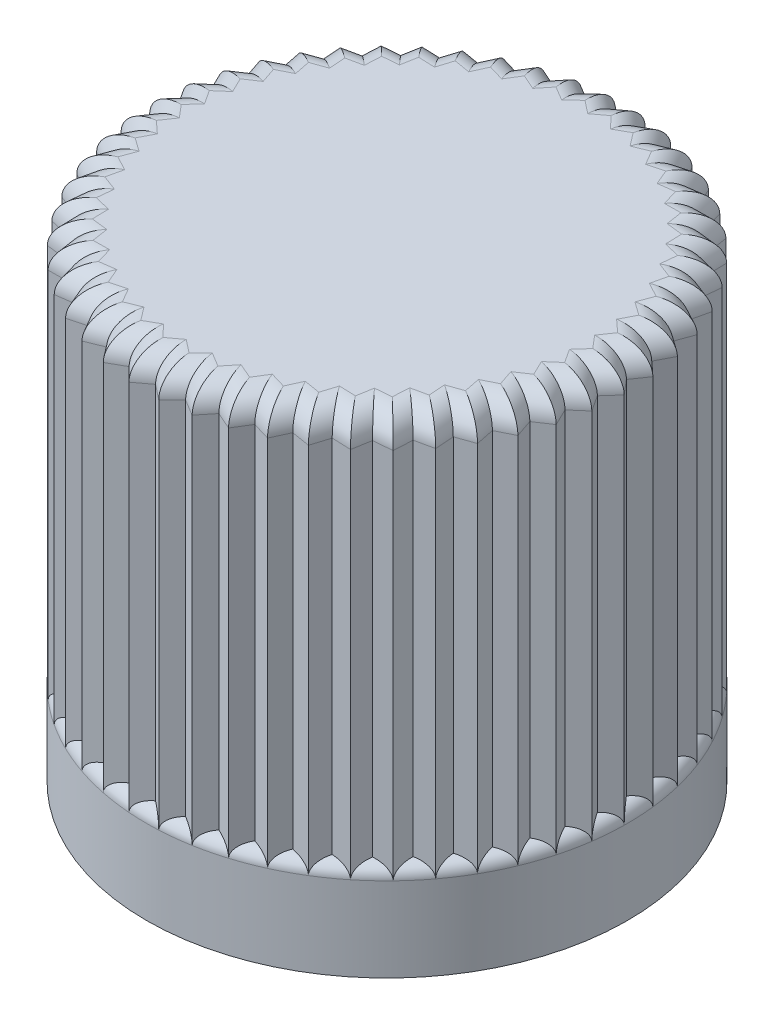
from build123d import *

# Parameters (mm, degrees)
SKETCH1_R           = 10
BOSS_EXTRUDE1_DEPTH = 20
SKETCH2_R           = 3.125
CUT_EXTRUDE1_DEPTH  = 17
SKETCH3_R           = 6
CUT_EXTRUDE2_DEPTH  = 4
SKETCH4_OUTSIDE_W   = 28.928
SKETCH4_OUTSIDE_H   = 28.928
CUT_EXTRUDE4_DEPTH  = 16
FILLET1_R           = 0.5
FILLET2_R           = 1


with BuildPart() as part:
    # Sketch1 → Boss-Extrude1 (new body)
    with BuildSketch(Plane(origin=(0, 0, 0), x_dir=(1, 0, 0), z_dir=(0, 1, 0))):
        with Locations(Location((0, 0, 0), (0, 0, 270))):
            Circle(SKETCH1_R)
    extrude(amount=BOSS_EXTRUDE1_DEPTH)

    # Sketch2 → Cut-Extrude1 (cut)
    with BuildSketch(Plane.XZ):
        with Locations(Location((0, 0, 0), (0, 0, 270))):
            Circle(SKETCH2_R)
    extrude(amount=-CUT_EXTRUDE1_DEPTH, mode=Mode.SUBTRACT)

    # Sketch3 → Cut-Extrude2 (cut)
    with BuildSketch(Plane.XZ):
        with Locations(Location((0, 0, 0), (0, 0, 270))):
            Circle(SKETCH3_R)
    extrude(amount=-CUT_EXTRUDE2_DEPTH, mode=Mode.SUBTRACT)

    # Sketch4 outside → Cut-Extrude4 (cut)
    with BuildSketch(Plane(origin=(0, 20, 0), x_dir=(1, 0, 0), z_dir=(0, 1, 0))):
        Rectangle(SKETCH4_OUTSIDE_W, SKETCH4_OUTSIDE_H)
        Polygon((9.307159291, -1.904412227), (9.651804953, -2.615848076), (8.995083418, -3.055891737), (9.24784489, -3.804913257), (8.541149705, -4.159178009), (8.698040789, -4.933972683), (7.95251696, -5.196871559), (8.011063389, -5.985220412), (7.238468272, -6.15260734), (7.197746733, -6.94207764), (6.410264614, -7.011312828), (6.270917312, -7.789454157), (5.480967255, -7.759445724), (5.245191779, -8.513986329), (4.465231768, -8.385207526), (4.136746438, -9.10424785), (3.379076908, -8.878729597), (2.963062134, -9.550929944), (2.239631987, -9.232228797), (1.742648571, -9.846988167), (1.064866732, -9.440130234), (0.494752399, -9.987753504), (-0.126692108, -9.499155179), (-0.760946314, -9.971006003), (-1.316252937, -9.408372771), (-2.00464445, -9.79700978), (-2.485055672, -9.169214705), (-3.216728144, -9.468508861), (-3.614667594, -8.785452645), (-4.378082115, -8.9906839), (-4.687274049, -8.263138749), (-5.470391115, -8.371070484), (-5.685959392, -7.610510219), (-6.476428779, -7.619440286), (-6.594973758, -6.837859397), (-7.380329293, -6.747646963), (-7.399981449, -5.957371446), (-8.167837605, -5.769439216), (-8.088287012, -4.98293219), (-8.826534238, -4.700243966), (-8.649035457, -3.929909116), (-9.346031154, -3.556923061), (-9.073383446, -2.814909028), (-9.718135576, -2.357507355), (-9.354638758, -1.655516143), (-9.936979194, -1.120912349), (-9.488365829, -0.470014779), (-9.999110714, 0.133360114), (-9.472455703, 0.722898999), (-9.903550286, 1.385529408), (-9.307159291, 1.904412227), (-9.651804953, 2.615848076), (-8.995083418, 3.055891737), (-9.24784489, 3.804913257), (-8.541149705, 4.159178009), (-8.698040789, 4.933972683), (-7.95251696, 5.196871559), (-8.011063389, 5.985220412), (-7.238468272, 6.15260734), (-7.197746733, 6.94207764), (-6.410264614, 7.011312828), (-6.270917312, 7.789454157), (-5.480967255, 7.759445724), (-5.245191779, 8.513986329), (-4.465231768, 8.385207526), (-4.136746438, 9.10424785), (-3.379076908, 8.878729597), (-2.963062134, 9.550929944), (-2.239631987, 9.232228797), (-1.742648571, 9.846988167), (-1.064866732, 9.440130234), (-0.494752399, 9.987753504), (0.126692108, 9.499155179), (0.760946314, 9.971006003), (1.316252937, 9.408372771), (2.00464445, 9.79700978), (2.485055672, 9.169214705), (3.216728144, 9.468508861), (3.614667594, 8.785452645), (4.378082115, 8.9906839), (4.687274049, 8.263138749), (5.470391115, 8.371070484), (5.685959392, 7.610510219), (6.476428779, 7.619440286), (6.594973758, 6.837859397), (7.380329293, 6.747646963), (7.399981449, 5.957371446), (8.167837605, 5.769439216), (8.088287012, 4.98293219), (8.826534238, 4.700243966), (8.649035457, 3.929909116), (9.346031154, 3.556923061), (9.073383446, 2.814909028), (9.718135576, 2.357507355), (9.354638758, 1.655516143), (9.936979194, 1.120912349), (9.488365829, 0.470014779), (9.999110714, -0.133360114), (9.472455703, -0.722898999), (9.903550286, -1.385529408), align=None, mode=Mode.SUBTRACT)
    extrude(amount=-CUT_EXTRUDE4_DEPTH, mode=Mode.SUBTRACT)

    # Fillet1
    # the kernel refuses this fillet: 0.5 mm, written as the material it takes off along each edge
    with BuildSketch(Plane(origin=(0, 4, 0), x_dir=(0.9999110714464502, 0, 0.01333601135317441), z_dir=(0.01333601135317441, 0, -0.9999110714464502))) as fillet1_piece_1_section:
        with BuildLine():
            CenterArc((10 - FILLET1_R, FILLET1_R), FILLET1_R, 270, 90)
            Line((10 - FILLET1_R, 0), (10, 0))
            Line((10, 0), (10, FILLET1_R))
        make_face()
    fillet1_piece_1 = revolve(axis=Axis((0, 4, 0), (0, -1, 0)), revolution_arc=7.2, mode=Mode.PRIVATE)
    fillet1_piece_1 = split(fillet1_piece_1, bisect_by=Plane(origin=(6.325043389, 4, -4.114951419), z_dir=(0.8382211116953275, 0, -0.545330512541018)), keep=Keep.TOP, mode=Mode.PRIVATE)
    fillet1_piece_1 = split(fillet1_piece_1, bisect_by=Plane(origin=(5.627358746, 4, 5.027109766), z_dir=(0.7457610349432742, 0, 0.6662135384096729)), keep=Keep.TOP, mode=Mode.PRIVATE)
    add(fillet1_piece_1, mode=Mode.SUBTRACT)
    with BuildSketch(Plane(origin=(0, 4, 0), x_dir=(0.9903550285633909, 0, 0.13855294078151292), z_dir=(0.13855294078151292, 0, -0.9903550285633909))) as fillet1_piece_2_section:
        with BuildLine():
            CenterArc((10 - FILLET1_R, FILLET1_R), FILLET1_R, 270, 90)
            Line((10 - FILLET1_R, 0), (10, 0))
            Line((10, 0), (10, FILLET1_R))
        make_face()
    fillet1_piece_2 = revolve(axis=Axis((0, 4, 0), (0, -1, 0)), revolution_arc=7.2, mode=Mode.PRIVATE)
    fillet1_piece_2 = split(fillet1_piece_2, bisect_by=Plane(origin=(4.952921419, 4, 5.692764573), z_dir=(0.6563817894215191, 0, 0.7544288876466784)), keep=Keep.TOP, mode=Mode.PRIVATE)
    fillet1_piece_2 = split(fillet1_piece_2, bisect_by=Plane(origin=(6.7909087, 4, -3.289765658), z_dir=(0.8999595243631443, 0, -0.4359734561966625)), keep=Keep.TOP, mode=Mode.PRIVATE)
    add(fillet1_piece_2, mode=Mode.SUBTRACT)
    with BuildSketch(Plane(origin=(0, 4, 0), x_dir=(0.965180495270469, 0, 0.26158480756621205), z_dir=(0.26158480756621205, 0, -0.965180495270469))) as fillet1_piece_3_section:
        with BuildLine():
            CenterArc((10 - FILLET1_R, FILLET1_R), FILLET1_R, 270, 90)
            Line((10 - FILLET1_R, 0), (10, 0))
            Line((10, 0), (10, FILLET1_R))
        make_face()
    fillet1_piece_3 = revolve(axis=Axis((0, 4, 0), (0, -1, 0)), revolution_arc=7.2, mode=Mode.PRIVATE)
    fillet1_piece_3 = split(fillet1_piece_3, bisect_by=Plane(origin=(7.149677325, 4, -2.412698327), z_dir=(0.9475050377219923, 0, -0.3197408380101701)), keep=Keep.TOP, mode=Mode.PRIVATE)
    fillet1_piece_3 = split(fillet1_piece_3, bisect_by=Plane(origin=(4.200373563, 4, 6.268641081), z_dir=(0.556651010977117, 0, 0.830746442651519)), keep=Keep.TOP, mode=Mode.PRIVATE)
    add(fillet1_piece_3, mode=Mode.SUBTRACT)
    with BuildSketch(Plane(origin=(0, 4, 0), x_dir=(0.9247844889962517, 0, 0.38049132567240146), z_dir=(0.38049132567240146, 0, -0.9247844889962517))) as fillet1_piece_4_section:
        with BuildLine():
            CenterArc((10 - FILLET1_R, FILLET1_R), FILLET1_R, 270, 90)
            Line((10 - FILLET1_R, 0), (10, 0))
            Line((10, 0), (10, FILLET1_R))
        make_face()
    fillet1_piece_4 = revolve(axis=Axis((0, 4, 0), (0, -1, 0)), revolution_arc=7.2, mode=Mode.PRIVATE)
    fillet1_piece_4 = split(fillet1_piece_4, bisect_by=Plane(origin=(7.395691266, 4, -1.497581302), z_dir=(0.9801078306238932, 0, -0.1984657158043319)), keep=Keep.TOP, mode=Mode.PRIVATE)
    fillet1_piece_4 = split(fillet1_piece_4, bisect_by=Plane(origin=(3.381583306, 4, 6.745657374), z_dir=(0.4481415135624047, 0, 0.8939626299918789)), keep=Keep.TOP, mode=Mode.PRIVATE)
    add(fillet1_piece_4, mode=Mode.SUBTRACT)
    with BuildSketch(Plane(origin=(0, 4, 0), x_dir=(0.8698040788910874, 0, 0.49339726827823754), z_dir=(0.49339726827823754, 0, -0.8698040788910874))) as fillet1_piece_5_section:
        with BuildLine():
            CenterArc((10 - FILLET1_R, FILLET1_R), FILLET1_R, 270, 90)
            Line((10 - FILLET1_R, 0), (10, 0))
            Line((10, 0), (10, FILLET1_R))
        make_face()
    fillet1_piece_5 = revolve(axis=Axis((0, 4, 0), (0, -1, 0)), revolution_arc=7.2, mode=Mode.PRIVATE)
    fillet1_piece_5 = split(fillet1_piece_5, bisect_by=Plane(origin=(7.525070739, 4, -0.558846525), z_dir=(0.9972537375488157, 0, -0.07406067070259273)), keep=Keep.TOP, mode=Mode.PRIVATE)
    fillet1_piece_5 = split(fillet1_piece_5, bisect_by=Plane(origin=(2.50946346, 4, 7.116290621), z_dir=(0.33256455677205254, 0, 0.9430804926298753)), keep=Keep.TOP, mode=Mode.PRIVATE)
    add(fillet1_piece_5, mode=Mode.SUBTRACT)
    with BuildSketch(Plane(origin=(0, 4, 0), x_dir=(0.8011063388660394, 0, 0.5985220412220842), z_dir=(0.5985220412220842, 0, -0.8011063388660394))) as fillet1_piece_6_section:
        with BuildLine():
            CenterArc((10 - FILLET1_R, FILLET1_R), FILLET1_R, 270, 90)
            Line((10 - FILLET1_R, 0), (10, 0))
            Line((10, 0), (10, FILLET1_R))
        make_face()
    fillet1_piece_6 = revolve(axis=Axis((0, 4, 0), (0, -1, 0)), revolution_arc=7.2, mode=Mode.PRIVATE)
    fillet1_piece_6 = split(fillet1_piece_6, bisect_by=Plane(origin=(7.53577535, 4, 0.388701595), z_dir=(0.998672357302087, 0, 0.05151235541782974)), keep=Keep.TOP, mode=Mode.PRIVATE)
    fillet1_piece_6 = split(fillet1_piece_6, bisect_by=Plane(origin=(1.597767877, 4, 7.374695714), z_dir=(0.21174285825696554, 0, 0.9773254125301207)), keep=Keep.TOP, mode=Mode.PRIVATE)
    add(fillet1_piece_6, mode=Mode.SUBTRACT)
    with BuildSketch(Plane(origin=(0, 4, 0), x_dir=(0.719774673319344, 0, 0.6942077640361217), z_dir=(0.6942077640361217, 0, -0.719774673319344))) as fillet1_piece_7_section:
        with BuildLine():
            CenterArc((10 - FILLET1_R, FILLET1_R), FILLET1_R, 270, 90)
            Line((10 - FILLET1_R, 0), (10, 0))
            Line((10, 0), (10, FILLET1_R))
        make_face()
    fillet1_piece_7 = revolve(axis=Axis((0, 4, 0), (0, -1, 0)), revolution_arc=7.2, mode=Mode.PRIVATE)
    fillet1_piece_7 = split(fillet1_piece_7, bisect_by=Plane(origin=(7.427636283, 4, 1.330119659), z_dir=(0.9843413174027552, 0, 0.1762730009213218)), keep=Keep.TOP, mode=Mode.PRIVATE)
    fillet1_piece_7 = split(fillet1_piece_7, bisect_by=Plane(origin=(0.660874539, 4, 7.51679745), z_dir=(0.08758184837811679, 0, 0.9961573268488632)), keep=Keep.TOP, mode=Mode.PRIVATE)
    add(fillet1_piece_7, mode=Mode.SUBTRACT)
    with BuildSketch(Plane(origin=(0, 4, 0), x_dir=(0.627091731201854, 0, 0.7789454157116926), z_dir=(0.7789454157116926, 0, -0.627091731201854))) as fillet1_piece_8_section:
        with BuildLine():
            CenterArc((10 - FILLET1_R, FILLET1_R), FILLET1_R, 270, 90)
            Line((10 - FILLET1_R, 0), (10, 0))
            Line((10, 0), (10, FILLET1_R))
        make_face()
    fillet1_piece_8 = revolve(axis=Axis((0, 4, 0), (0, -1, 0)), revolution_arc=7.2, mode=Mode.PRIVATE)
    fillet1_piece_8 = split(fillet1_piece_8, bisect_by=Plane(origin=(7.202358955, 4, 2.250560941), z_dir=(0.9544866269109806, 0, 0.2982537158999004)), keep=Keep.TOP, mode=Mode.PRIVATE)
    fillet1_piece_8 = split(fillet1_piece_8, bisect_by=Plane(origin=(-0.286441184, 4, 7.5403548), z_dir=(-0.03796037956851627, 0, 0.9992792450476564)), keep=Keep.TOP, mode=Mode.PRIVATE)
    add(fillet1_piece_8, mode=Mode.SUBTRACT)
    with BuildSketch(Plane(origin=(0, 4, 0), x_dir=(0.5245191778768692, 0, 0.8513986328620533), z_dir=(0.8513986328620533, 0, -0.5245191778768692))) as fillet1_piece_9_section:
        with BuildLine():
            CenterArc((10 - FILLET1_R, FILLET1_R), FILLET1_R, 270, 90)
            Line((10 - FILLET1_R, 0), (10, 0))
            Line((10, 0), (10, FILLET1_R))
        make_face()
    fillet1_piece_9 = revolve(axis=Axis((0, 4, 0), (0, -1, 0)), revolution_arc=7.2, mode=Mode.PRIVATE)
    fillet1_piece_9 = split(fillet1_piece_9, bisect_by=Plane(origin=(6.863496123, 4, 3.135509533), z_dir=(0.9095791121301484, 0, 0.41553079161059897)), keep=Keep.TOP, mode=Mode.PRIVATE)
    fillet1_piece_9 = split(fillet1_piece_9, bisect_by=Plane(origin=(-1.229239559, 4, 7.44499625), z_dir=(-0.16290394965292143, 0, 0.9866419326115622)), keep=Keep.TOP, mode=Mode.PRIVATE)
    add(fillet1_piece_9, mode=Mode.SUBTRACT)
    with BuildSketch(Plane(origin=(0, 4, 0), x_dir=(0.4136746437841964, 0, 0.9104247849712893), z_dir=(0.9104247849712893, 0, -0.4136746437841964))) as fillet1_piece_10_section:
        with BuildLine():
            CenterArc((10 - FILLET1_R, FILLET1_R), FILLET1_R, 270, 90)
            Line((10 - FILLET1_R, 0), (10, 0))
            Line((10, 0), (10, FILLET1_R))
        make_face()
    fillet1_piece_10 = revolve(axis=Axis((0, 4, 0), (0, -1, 0)), revolution_arc=7.2, mode=Mode.PRIVATE)
    fillet1_piece_10 = split(fillet1_piece_10, bisect_by=Plane(origin=(6.416391857, 4, 3.971009267), z_dir=(0.8503269913947983, 0, 0.5262546985115389)), keep=Keep.TOP, mode=Mode.PRIVATE)
    fillet1_piece_10 = split(fillet1_piece_10, bisect_by=Plane(origin=(-2.152652092, 4, 7.232225662), z_dir=(-0.28527842713720053, 0, 0.9584446875068613)), keep=Keep.TOP, mode=Mode.PRIVATE)
    add(fillet1_piece_10, mode=Mode.SUBTRACT)
    with BuildSketch(Plane(origin=(0, 4, 0), x_dir=(0.29630621344179275, 0, 0.9550929943601234), z_dir=(0.9550929943601234, 0, -0.29630621344179275))) as fillet1_piece_11_section:
        with BuildLine():
            CenterArc((10 - FILLET1_R, FILLET1_R), FILLET1_R, 270, 90)
            Line((10 - FILLET1_R, 0), (10, 0))
            Line((10, 0), (10, FILLET1_R))
        make_face()
    fillet1_piece_11 = revolve(axis=Axis((0, 4, 0), (0, -1, 0)), revolution_arc=7.2, mode=Mode.PRIVATE)
    fillet1_piece_11 = split(fillet1_piece_11, bisect_by=Plane(origin=(5.868097259, 4, 4.743883812), z_dir=(0.7776647060444283, 0, 0.6286792544476341)), keep=Keep.TOP, mode=Mode.PRIVATE)
    fillet1_piece_11 = split(fillet1_piece_11, bisect_by=Plane(origin=(-3.042116016, 4, 6.905398556), z_dir=(-0.4031538934084505, 0, 0.9151321971330741)), keep=Keep.TOP, mode=Mode.PRIVATE)
    add(fillet1_piece_11, mode=Mode.SUBTRACT)
    with BuildSketch(Plane(origin=(0, 4, 0), x_dir=(0.1742648571086599, 0, 0.984698816682999), z_dir=(0.984698816682999, 0, -0.1742648571086599))) as fillet1_piece_12_section:
        with BuildLine():
            CenterArc((10 - FILLET1_R, FILLET1_R), FILLET1_R, 270, 90)
            Line((10 - FILLET1_R, 0), (10, 0))
            Line((10, 0), (10, FILLET1_R))
        make_face()
    fillet1_piece_12 = revolve(axis=Axis((0, 4, 0), (0, -1, 0)), revolution_arc=7.2, mode=Mode.PRIVATE)
    fillet1_piece_12 = split(fillet1_piece_12, bisect_by=Plane(origin=(5.227259262, 4, 5.441944475), z_dir=(0.6927381837253628, 0, 0.7211891629863039)), keep=Keep.TOP, mode=Mode.PRIVATE)
    fillet1_piece_12 = split(fillet1_piece_12, bisect_by=Plane(origin=(-3.883603952, 4, 6.469669188), z_dir=(-0.5146713819481865, 0, 0.8573875253370229)), keep=Keep.TOP, mode=Mode.PRIVATE)
    add(fillet1_piece_12, mode=Mode.SUBTRACT)
    with BuildSketch(Plane(origin=(0, 4, 0), x_dir=(0, 0, 1), z_dir=(1, 0, 0))) as fillet1_piece_13_section:
        with BuildLine():
            CenterArc((10 - FILLET1_R, FILLET1_R), FILLET1_R, 270, 90)
            Line((10 - FILLET1_R, 0), (10, 0))
            Line((10, 0), (10, FILLET1_R))
        make_face()
    fillet1_piece_13 = revolve(axis=Axis((0, 4, 0), (0, -1, 0)), revolution_arc=4.364119817, mode=Mode.PRIVATE)
    fillet1_piece_13 = split(fillet1_piece_13, bisect_by=Plane(origin=(4.503984263, 4, 6.054182424), z_dir=(0.596886766427215, 0, 0.8023254876071576)), keep=Keep.TOP, mode=Mode.PRIVATE)
    fillet1_piece_13 = split(fillet1_piece_13, bisect_by=Plane(origin=(-4.663845134, 4, 5.931909273), z_dir=(-0.6180721953448227, 0, 0.7861213400879227)), keep=Keep.TOP, mode=Mode.PRIVATE)
    add(fillet1_piece_13, mode=Mode.SUBTRACT)
    with BuildSketch(Plane(origin=(0, 4, 0), x_dir=(-0.07609463144032622, 0, 0.9971006002735937), z_dir=(0.9971006002735937, 0, 0.07609463144032622))) as fillet1_piece_14_section:
        with BuildLine():
            CenterArc((10 - FILLET1_R, FILLET1_R), FILLET1_R, 270, 90)
            Line((10 - FILLET1_R, 0), (10, 0))
            Line((10, 0), (10, FILLET1_R))
        make_face()
    fillet1_piece_14 = revolve(axis=Axis((0, 4, 0), (0, -1, 0)), revolution_arc=7.2, mode=Mode.PRIVATE)
    fillet1_piece_14 = split(fillet1_piece_14, bisect_by=Plane(origin=(3.709678742, 4, 6.570942299), z_dir=(0.4916220882596396, 0, 0.870808660002432)), keep=Keep.TOP, mode=Mode.PRIVATE)
    fillet1_piece_14 = split(fillet1_piece_14, bisect_by=Plane(origin=(-5.370534693, 4, 5.300599605), z_dir=(-0.7117256410024367, 0, 0.7024575516995105)), keep=Keep.TOP, mode=Mode.PRIVATE)
    add(fillet1_piece_14, mode=Mode.SUBTRACT)
    with BuildSketch(Plane(origin=(0, 4, 0), x_dir=(-0.20046444496425275, 0, 0.9797009780056228), z_dir=(0.9797009780056228, 0, 0.20046444496425275))) as fillet1_piece_15_section:
        with BuildLine():
            CenterArc((10 - FILLET1_R, FILLET1_R), FILLET1_R, 270, 90)
            Line((10 - FILLET1_R, 0), (10, 0))
            Line((10, 0), (10, FILLET1_R))
        make_face()
    fillet1_piece_15 = revolve(axis=Axis((0, 4, 0), (0, -1, 0)), revolution_arc=7.2, mode=Mode.PRIVATE)
    fillet1_piece_15 = split(fillet1_piece_15, bisect_by=Plane(origin=(2.856869372, 4, 6.984074488), z_dir=(0.3786042360794077, 0, 0.9255586596335903)), keep=Keep.TOP, mode=Mode.PRIVATE)
    fillet1_piece_15 = split(fillet1_piece_15, bisect_by=Plane(origin=(-5.992527711, 4, 4.585696315), z_dir=(-0.7941547481371508, 0, 0.6077155880929982)), keep=Keep.TOP, mode=Mode.PRIVATE)
    add(fillet1_piece_15, mode=Mode.SUBTRACT)
    with BuildSketch(Plane(origin=(0, 4, 0), x_dir=(-0.3216728144394381, 0, 0.9468508860695071), z_dir=(0.9468508860695071, 0, 0.3216728144394381))) as fillet1_piece_16_section:
        with BuildLine():
            CenterArc((10 - FILLET1_R, FILLET1_R), FILLET1_R, 270, 90)
            Line((10 - FILLET1_R, 0), (10, 0))
            Line((10, 0), (10, FILLET1_R))
        make_face()
    fillet1_piece_16 = revolve(axis=Axis((0, 4, 0), (0, -1, 0)), revolution_arc=7.2, mode=Mode.PRIVATE)
    fillet1_piece_16 = split(fillet1_piece_16, bisect_by=Plane(origin=(1.959005464, 4, 7.287063651), z_dir=(0.25961556892899884, 0, 0.9657120463003827)), keep=Keep.TOP, mode=Mode.PRIVATE)
    fillet1_piece_16 = split(fillet1_piece_16, bisect_by=Plane(origin=(-6.520014988, 4, 3.798473855), z_dir=(-0.8640595604886911, 0, 0.503389586630564)), keep=Keep.TOP, mode=Mode.PRIVATE)
    add(fillet1_piece_16, mode=Mode.SUBTRACT)
    with BuildSketch(Plane(origin=(0, 4, 0), x_dir=(-0.4378082114728888, 0, 0.8990683900387726), z_dir=(0.8990683900387726, 0, 0.4378082114728888))) as fillet1_piece_17_section:
        with BuildLine():
            CenterArc((10 - FILLET1_R, FILLET1_R), FILLET1_R, 270, 90)
            Line((10 - FILLET1_R, 0), (10, 0))
            Line((10, 0), (10, FILLET1_R))
        make_face()
    fillet1_piece_17 = revolve(axis=Axis((0, 4, 0), (0, -1, 0)), revolution_arc=7.2, mode=Mode.PRIVATE)
    fillet1_piece_17 = split(fillet1_piece_17, bisect_by=Plane(origin=(1.03024687, 4, 7.475131467), z_dir=(0.13653260916974966, 0, 0.9906355771086058)), keep=Keep.TOP, mode=Mode.PRIVATE)
    fillet1_piece_17 = split(fillet1_piece_17, bisect_by=Plane(origin=(-6.944677733, 4, 2.951347193), z_dir=(-0.920337637407165, 0, 0.3911248306765984)), keep=Keep.TOP, mode=Mode.PRIVATE)
    add(fillet1_piece_17, mode=Mode.SUBTRACT)
    with BuildSketch(Plane(origin=(0, 4, 0), x_dir=(-0.5470391114774633, 0, 0.8371070484197032), z_dir=(0.8371070484197032, 0, 0.5470391114774633))) as fillet1_piece_18_section:
        with BuildLine():
            CenterArc((10 - FILLET1_R, FILLET1_R), FILLET1_R, 270, 90)
            Line((10 - FILLET1_R, 0), (10, 0))
            Line((10, 0), (10, FILLET1_R))
        make_face()
    fillet1_piece_18 = revolve(axis=Axis((0, 4, 0), (0, -1, 0)), revolution_arc=7.2, mode=Mode.PRIVATE)
    fillet1_piece_18 = split(fillet1_piece_18, bisect_by=Plane(origin=(0.085240668, 4, 7.545311994), z_dir=(0.011296448603270651, 0, 0.9999361930888159)), keep=Keep.TOP, mode=Mode.PRIVATE)
    fillet1_piece_18 = split(fillet1_piece_18, bisect_by=Plane(origin=(-7.259818762, 4, 2.057676022), z_dir=(-0.9621014400006704, 0, 0.2726918024962182)), keep=Keep.TOP, mode=Mode.PRIVATE)
    add(fillet1_piece_18, mode=Mode.SUBTRACT)
    with BuildSketch(Plane(origin=(0, 4, 0), x_dir=(-0.6476428779087129, 0, 0.7619440285835436), z_dir=(0.7619440285835436, 0, 0.6476428779087129))) as fillet1_piece_19_section:
        with BuildLine():
            CenterArc((10 - FILLET1_R, FILLET1_R), FILLET1_R, 270, 90)
            Line((10 - FILLET1_R, 0), (10, 0))
            Line((10, 0), (10, FILLET1_R))
        make_face()
    fillet1_piece_19 = revolve(axis=Axis((0, 4, 0), (0, -1, 0)), revolution_arc=7.2, mode=Mode.PRIVATE)
    fillet1_piece_19 = split(fillet1_piece_19, bisect_by=Plane(origin=(-0.861109831, 4, 7.496498444), z_dir=(-0.11411786370585471, 0, 0.9934672179710874)), keep=Keep.TOP, mode=Mode.PRIVATE)
    fillet1_piece_19 = split(fillet1_piece_19, bisect_by=Plane(origin=(-7.460468112, 4, 1.131554072), z_dir=(-0.9886923281538235, 0, 0.14995826169228682)), keep=Keep.TOP, mode=Mode.PRIVATE)
    add(fillet1_piece_19, mode=Mode.SUBTRACT)
    with BuildSketch(Plane(origin=(0, 4, 0), x_dir=(-0.7380329292722397, 0, 0.6747646962533214), z_dir=(0.6747646962533214, 0, 0.7380329292722397))) as fillet1_piece_20_section:
        with BuildLine():
            CenterArc((10 - FILLET1_R, FILLET1_R), FILLET1_R, 270, 90)
            Line((10 - FILLET1_R, 0), (10, 0))
            Line((10, 0), (10, FILLET1_R))
        make_face()
    fillet1_piece_20 = revolve(axis=Axis((0, 4, 0), (0, -1, 0)), revolution_arc=7.2, mode=Mode.PRIVATE)
    fillet1_piece_20 = split(fillet1_piece_20, bisect_by=Plane(origin=(-1.793880113, 4, 7.329460635), z_dir=(-0.23773246913362764, 0, 0.9713306713574059)), keep=Keep.TOP, mode=Mode.PRIVATE)
    fillet1_piece_20 = split(fillet1_piece_20, bisect_by=Plane(origin=(-7.543461423, 4, 0.187586837), z_dir=(-0.9996909476758228, 0, 0.024859789520738855)), keep=Keep.TOP, mode=Mode.PRIVATE)
    add(fillet1_piece_20, mode=Mode.SUBTRACT)
    with BuildSketch(Plane(origin=(0, 4, 0), x_dir=(-0.8167837604616416, 0, 0.5769439215782933), z_dir=(0.5769439215782933, 0, 0.8167837604616416))) as fillet1_piece_21_section:
        with BuildLine():
            CenterArc((10 - FILLET1_R, FILLET1_R), FILLET1_R, 270, 90)
            Line((10 - FILLET1_R, 0), (10, 0))
            Line((10, 0), (10, FILLET1_R))
        make_face()
    fillet1_piece_21 = revolve(axis=Axis((0, 4, 0), (0, -1, 0)), revolution_arc=7.2, mode=Mode.PRIVATE)
    fillet1_piece_21 = split(fillet1_piece_21, bisect_by=Plane(origin=(-2.698359834, 4, 7.046832854), z_dir=(-0.35759789150867455, 0, 0.9338756598115995)), keep=Keep.TOP, mode=Mode.PRIVATE)
    fillet1_piece_21 = split(fillet1_piece_21, bisect_by=Plane(origin=(-7.507489842, 4, -0.759338753), z_dir=(-0.9949238437665489, 0, -0.10063073638206234)), keep=Keep.TOP, mode=Mode.PRIVATE)
    add(fillet1_piece_21, mode=Mode.SUBTRACT)
    with BuildSketch(Plane(origin=(0, 4, 0), x_dir=(-0.8826534238255952, 0, 0.4700243966103822), z_dir=(0.4700243966103822, 0, 0.8826534238255952))) as fillet1_piece_22_section:
        with BuildLine():
            CenterArc((10 - FILLET1_R, FILLET1_R), FILLET1_R, 270, 90)
            Line((10 - FILLET1_R, 0), (10, 0))
            Line((10, 0), (10, FILLET1_R))
        make_face()
    fillet1_piece_22 = revolve(axis=Axis((0, 4, 0), (0, -1, 0)), revolution_arc=7.2, mode=Mode.PRIVATE)
    fillet1_piece_22 = split(fillet1_piece_22, bisect_by=Plane(origin=(-3.560284809, 4, 6.653072309), z_dir=(-0.47182378151600035, 0, 0.8816928712402872)), keep=Keep.TOP, mode=Mode.PRIVATE)
    fillet1_piece_22 = split(fillet1_piece_22, bisect_by=Plane(origin=(-7.35312066, 4, -1.694289118), z_dir=(-0.9744661965023799, 0, -0.22453425545823807)), keep=Keep.TOP, mode=Mode.PRIVATE)
    add(fillet1_piece_22, mode=Mode.SUBTRACT)
    with BuildSketch(Plane(origin=(0, 4, 0), x_dir=(-0.9346031154242219, 0, 0.3556923061289612), z_dir=(0.3556923061289612, 0, 0.9346031154242219))) as fillet1_piece_23_section:
        with BuildLine():
            CenterArc((10 - FILLET1_R, FILLET1_R), FILLET1_R, 270, 90)
            Line((10 - FILLET1_R, 0), (10, 0))
            Line((10, 0), (10, FILLET1_R))
        make_face()
    fillet1_piece_23 = revolve(axis=Axis((0, 4, 0), (0, -1, 0)), revolution_arc=7.2, mode=Mode.PRIVATE)
    fillet1_piece_23 = split(fillet1_piece_23, bisect_by=Plane(origin=(-4.366061965, 4, 6.154388839), z_dir=(-0.578608728634955, 0, 0.8156052593917237)), keep=Keep.TOP, mode=Mode.PRIVATE)
    fillet1_piece_23 = split(fillet1_piece_23, bisect_by=Plane(origin=(-7.082788374, 4, -2.602519532), z_dir=(-0.9386406352014821, 0, -0.34489673519556313)), keep=Keep.TOP, mode=Mode.PRIVATE)
    add(fillet1_piece_23, mode=Mode.SUBTRACT)
    with BuildSketch(Plane(origin=(0, 4, 0), x_dir=(-0.9718135575877694, 0, 0.23575073549960157), z_dir=(0.23575073549960157, 0, 0.9718135575877694))) as fillet1_piece_24_section:
        with BuildLine():
            CenterArc((10 - FILLET1_R, FILLET1_R), FILLET1_R, 270, 90)
            Line((10 - FILLET1_R, 0), (10, 0))
            Line((10, 0), (10, FILLET1_R))
        make_face()
    fillet1_piece_24 = revolve(axis=Axis((0, 4, 0), (0, -1, 0)), revolution_arc=7.2, mode=Mode.PRIVATE)
    fillet1_piece_24 = split(fillet1_piece_24, bisect_by=Plane(origin=(-5.102983716, 4, 5.558646981), z_dir=(-0.6762686704592366, 0, 0.7366550653835868)), keep=Keep.TOP, mode=Mode.PRIVATE)
    fillet1_piece_24 = split(fillet1_piece_24, bisect_by=Plane(origin=(-6.700756284, 4, -3.469706657), z_dir=(-0.8880121503667155, 0, -0.459819987387545)), keep=Keep.TOP, mode=Mode.PRIVATE)
    add(fillet1_piece_24, mode=Mode.SUBTRACT)
    with BuildSketch(Plane(origin=(0, 4, 0), x_dir=(-0.9936979194148782, 0, 0.11209123494075017), z_dir=(0.11209123494075017, 0, 0.9936979194148782))) as fillet1_piece_25_section:
        with BuildLine():
            CenterArc((10 - FILLET1_R, FILLET1_R), FILLET1_R, 270, 90)
            Line((10 - FILLET1_R, 0), (10, 0))
            Line((10, 0), (10, FILLET1_R))
        make_face()
    fillet1_piece_25 = revolve(axis=Axis((0, 4, 0), (0, -1, 0)), revolution_arc=7.2, mode=Mode.PRIVATE)
    fillet1_piece_25 = split(fillet1_piece_25, bisect_by=Plane(origin=(-5.759428366, 4, 4.875241939), z_dir=(-0.763263451367055, 0, 0.6460873809379436)), keep=Keep.TOP, mode=Mode.PRIVATE)
    fillet1_piece_25 = split(fillet1_piece_25, bisect_by=Plane(origin=(-6.213049264, 4, -4.282174436), z_dir=(-0.8233791834479235, 0, -0.5674916036952713)), keep=Keep.TOP, mode=Mode.PRIVATE)
    add(fillet1_piece_25, mode=Mode.SUBTRACT)
    with BuildSketch(Plane(origin=(0, 4, 0), x_dir=(-0.9999110714464502, 0, -0.013336011353174535), z_dir=(-0.013336011353174535, 0, 0.9999110714464502))) as fillet1_piece_26_section:
        with BuildLine():
            CenterArc((10 - FILLET1_R, FILLET1_R), FILLET1_R, 270, 90)
            Line((10 - FILLET1_R, 0), (10, 0))
            Line((10, 0), (10, FILLET1_R))
        make_face()
    fillet1_piece_26 = revolve(axis=Axis((0, 4, 0), (0, -1, 0)), revolution_arc=7.2, mode=Mode.PRIVATE)
    fillet1_piece_26 = split(fillet1_piece_26, bisect_by=Plane(origin=(-6.325043389, 4, 4.114951419), z_dir=(-0.8382211116953275, 0, 0.5453305125410178)), keep=Keep.TOP, mode=Mode.PRIVATE)
    fillet1_piece_26 = split(fillet1_piece_26, bisect_by=Plane(origin=(-5.627358746, 4, -5.027109766), z_dir=(-0.7457610349432768, 0, -0.6662135384096698)), keep=Keep.TOP, mode=Mode.PRIVATE)
    add(fillet1_piece_26, mode=Mode.SUBTRACT)
    with BuildSketch(Plane(origin=(0, 4, 0), x_dir=(-0.9903550285633906, 0, -0.13855294078151306), z_dir=(-0.13855294078151306, 0, 0.9903550285633906))) as fillet1_piece_27_section:
        with BuildLine():
            CenterArc((10 - FILLET1_R, FILLET1_R), FILLET1_R, 270, 90)
            Line((10 - FILLET1_R, 0), (10, 0))
            Line((10, 0), (10, FILLET1_R))
        make_face()
    fillet1_piece_27 = revolve(axis=Axis((0, 4, 0), (0, -1, 0)), revolution_arc=7.2, mode=Mode.PRIVATE)
    fillet1_piece_27 = split(fillet1_piece_27, bisect_by=Plane(origin=(-6.7909087, 4, 3.289765658), z_dir=(-0.8999595243631443, 0, 0.4359734561966624)), keep=Keep.TOP, mode=Mode.PRIVATE)
    fillet1_piece_27 = split(fillet1_piece_27, bisect_by=Plane(origin=(-4.952921419, 4, -5.692764573), z_dir=(-0.6563817894215223, 0, -0.7544288876466757)), keep=Keep.TOP, mode=Mode.PRIVATE)
    add(fillet1_piece_27, mode=Mode.SUBTRACT)
    with BuildSketch(Plane(origin=(0, 4, 0), x_dir=(-0.965180495270469, 0, -0.26158480756621216), z_dir=(-0.26158480756621216, 0, 0.965180495270469))) as fillet1_piece_28_section:
        with BuildLine():
            CenterArc((10 - FILLET1_R, FILLET1_R), FILLET1_R, 270, 90)
            Line((10 - FILLET1_R, 0), (10, 0))
            Line((10, 0), (10, FILLET1_R))
        make_face()
    fillet1_piece_28 = revolve(axis=Axis((0, 4, 0), (0, -1, 0)), revolution_arc=7.2, mode=Mode.PRIVATE)
    fillet1_piece_28 = split(fillet1_piece_28, bisect_by=Plane(origin=(-7.149677325, 4, 2.412698327), z_dir=(-0.9475050377219933, 0, 0.31974083801016745)), keep=Keep.TOP, mode=Mode.PRIVATE)
    fillet1_piece_28 = split(fillet1_piece_28, bisect_by=Plane(origin=(-4.200373563, 4, -6.268641081), z_dir=(-0.5566510109771139, 0, -0.8307464426515212)), keep=Keep.TOP, mode=Mode.PRIVATE)
    add(fillet1_piece_28, mode=Mode.SUBTRACT)
    with BuildSketch(Plane(origin=(0, 4, 0), x_dir=(-0.9247844889962515, 0, -0.380491325672402), z_dir=(-0.380491325672402, 0, 0.9247844889962515))) as fillet1_piece_29_section:
        with BuildLine():
            CenterArc((10 - FILLET1_R, FILLET1_R), FILLET1_R, 270, 90)
            Line((10 - FILLET1_R, 0), (10, 0))
            Line((10, 0), (10, FILLET1_R))
        make_face()
    fillet1_piece_29 = revolve(axis=Axis((0, 4, 0), (0, -1, 0)), revolution_arc=7.2, mode=Mode.PRIVATE)
    fillet1_piece_29 = split(fillet1_piece_29, bisect_by=Plane(origin=(-7.395691266, 4, 1.497581302), z_dir=(-0.9801078306238937, 0, 0.19846571580432953)), keep=Keep.TOP, mode=Mode.PRIVATE)
    fillet1_piece_29 = split(fillet1_piece_29, bisect_by=Plane(origin=(-3.381583306, 4, -6.745657374), z_dir=(-0.4481415135624065, 0, -0.893962629991878)), keep=Keep.TOP, mode=Mode.PRIVATE)
    add(fillet1_piece_29, mode=Mode.SUBTRACT)
    with BuildSketch(Plane(origin=(0, 4, 0), x_dir=(-0.8698040788910871, 0, -0.493397268278238), z_dir=(-0.493397268278238, 0, 0.8698040788910871))) as fillet1_piece_30_section:
        with BuildLine():
            CenterArc((10 - FILLET1_R, FILLET1_R), FILLET1_R, 270, 90)
            Line((10 - FILLET1_R, 0), (10, 0))
            Line((10, 0), (10, FILLET1_R))
        make_face()
    fillet1_piece_30 = revolve(axis=Axis((0, 4, 0), (0, -1, 0)), revolution_arc=7.2, mode=Mode.PRIVATE)
    fillet1_piece_30 = split(fillet1_piece_30, bisect_by=Plane(origin=(-7.525070739, 4, 0.558846525), z_dir=(-0.9972537375488159, 0, 0.07406067070259056)), keep=Keep.TOP, mode=Mode.PRIVATE)
    fillet1_piece_30 = split(fillet1_piece_30, bisect_by=Plane(origin=(-2.50946346, 4, -7.116290621), z_dir=(-0.33256455677205254, 0, -0.9430804926298753)), keep=Keep.TOP, mode=Mode.PRIVATE)
    add(fillet1_piece_30, mode=Mode.SUBTRACT)
    with BuildSketch(Plane(origin=(0, 4, 0), x_dir=(-0.8011063388660391, 0, -0.5985220412220846), z_dir=(-0.5985220412220846, 0, 0.8011063388660391))) as fillet1_piece_31_section:
        with BuildLine():
            CenterArc((10 - FILLET1_R, FILLET1_R), FILLET1_R, 270, 90)
            Line((10 - FILLET1_R, 0), (10, 0))
            Line((10, 0), (10, FILLET1_R))
        make_face()
    fillet1_piece_31 = revolve(axis=Axis((0, 4, 0), (0, -1, 0)), revolution_arc=7.2, mode=Mode.PRIVATE)
    fillet1_piece_31 = split(fillet1_piece_31, bisect_by=Plane(origin=(-7.53577535, 4, -0.388701595), z_dir=(-0.998672357302087, 0, -0.05151235541782963)), keep=Keep.TOP, mode=Mode.PRIVATE)
    fillet1_piece_31 = split(fillet1_piece_31, bisect_by=Plane(origin=(-1.597767877, 4, -7.374695714), z_dir=(-0.21174285825696434, 0, -0.9773254125301211)), keep=Keep.TOP, mode=Mode.PRIVATE)
    add(fillet1_piece_31, mode=Mode.SUBTRACT)
    with BuildSketch(Plane(origin=(0, 4, 0), x_dir=(-0.7197746733193439, 0, -0.6942077640361218), z_dir=(-0.6942077640361218, 0, 0.7197746733193439))) as fillet1_piece_32_section:
        with BuildLine():
            CenterArc((10 - FILLET1_R, FILLET1_R), FILLET1_R, 270, 90)
            Line((10 - FILLET1_R, 0), (10, 0))
            Line((10, 0), (10, FILLET1_R))
        make_face()
    fillet1_piece_32 = revolve(axis=Axis((0, 4, 0), (0, -1, 0)), revolution_arc=7.2, mode=Mode.PRIVATE)
    fillet1_piece_32 = split(fillet1_piece_32, bisect_by=Plane(origin=(-7.427636283, 4, -1.330119659), z_dir=(-0.9843413174027554, 0, -0.17627300092132053)), keep=Keep.TOP, mode=Mode.PRIVATE)
    fillet1_piece_32 = split(fillet1_piece_32, bisect_by=Plane(origin=(-0.660874539, 4, -7.51679745), z_dir=(-0.08758184837811539, 0, -0.9961573268488633)), keep=Keep.TOP, mode=Mode.PRIVATE)
    add(fillet1_piece_32, mode=Mode.SUBTRACT)
    with BuildSketch(Plane(origin=(0, 4, 0), x_dir=(-0.6270917312018538, 0, -0.7789454157116927), z_dir=(-0.7789454157116927, 0, 0.6270917312018538))) as fillet1_piece_33_section:
        with BuildLine():
            CenterArc((10 - FILLET1_R, FILLET1_R), FILLET1_R, 270, 90)
            Line((10 - FILLET1_R, 0), (10, 0))
            Line((10, 0), (10, FILLET1_R))
        make_face()
    fillet1_piece_33 = revolve(axis=Axis((0, 4, 0), (0, -1, 0)), revolution_arc=7.2, mode=Mode.PRIVATE)
    fillet1_piece_33 = split(fillet1_piece_33, bisect_by=Plane(origin=(-7.202358955, 4, -2.250560941), z_dir=(-0.9544866269109806, 0, -0.2982537158999004)), keep=Keep.TOP, mode=Mode.PRIVATE)
    fillet1_piece_33 = split(fillet1_piece_33, bisect_by=Plane(origin=(0.286441184, 4, -7.5403548), z_dir=(0.0379603795685186, 0, -0.9992792450476564)), keep=Keep.TOP, mode=Mode.PRIVATE)
    add(fillet1_piece_33, mode=Mode.SUBTRACT)
    with BuildSketch(Plane(origin=(0, 4, 0), x_dir=(-0.5245191778768687, 0, -0.8513986328620536), z_dir=(-0.8513986328620536, 0, 0.5245191778768687))) as fillet1_piece_34_section:
        with BuildLine():
            CenterArc((10 - FILLET1_R, FILLET1_R), FILLET1_R, 270, 90)
            Line((10 - FILLET1_R, 0), (10, 0))
            Line((10, 0), (10, FILLET1_R))
        make_face()
    fillet1_piece_34 = revolve(axis=Axis((0, 4, 0), (0, -1, 0)), revolution_arc=7.2, mode=Mode.PRIVATE)
    fillet1_piece_34 = split(fillet1_piece_34, bisect_by=Plane(origin=(-6.863496123, 4, -3.135509533), z_dir=(-0.9095791121301475, 0, -0.4155307916106008)), keep=Keep.TOP, mode=Mode.PRIVATE)
    fillet1_piece_34 = split(fillet1_piece_34, bisect_by=Plane(origin=(1.229239559, 4, -7.44499625), z_dir=(0.1629039496529211, 0, -0.9866419326115623)), keep=Keep.TOP, mode=Mode.PRIVATE)
    add(fillet1_piece_34, mode=Mode.SUBTRACT)
    with BuildSketch(Plane(origin=(0, 4, 0), x_dir=(-0.4136746437841958, 0, -0.9104247849712894), z_dir=(-0.9104247849712894, 0, 0.4136746437841958))) as fillet1_piece_35_section:
        with BuildLine():
            CenterArc((10 - FILLET1_R, FILLET1_R), FILLET1_R, 270, 90)
            Line((10 - FILLET1_R, 0), (10, 0))
            Line((10, 0), (10, FILLET1_R))
        make_face()
    fillet1_piece_35 = revolve(axis=Axis((0, 4, 0), (0, -1, 0)), revolution_arc=7.2, mode=Mode.PRIVATE)
    fillet1_piece_35 = split(fillet1_piece_35, bisect_by=Plane(origin=(-6.416391857, 4, -3.971009267), z_dir=(-0.8503269913947983, 0, -0.5262546985115389)), keep=Keep.TOP, mode=Mode.PRIVATE)
    fillet1_piece_35 = split(fillet1_piece_35, bisect_by=Plane(origin=(2.152652092, 4, -7.232225662), z_dir=(0.28527842713720103, 0, -0.9584446875068612)), keep=Keep.TOP, mode=Mode.PRIVATE)
    add(fillet1_piece_35, mode=Mode.SUBTRACT)
    with BuildSketch(Plane(origin=(0, 4, 0), x_dir=(-0.29630621344179225, 0, -0.9550929943601236), z_dir=(-0.9550929943601236, 0, 0.29630621344179225))) as fillet1_piece_36_section:
        with BuildLine():
            CenterArc((10 - FILLET1_R, FILLET1_R), FILLET1_R, 270, 90)
            Line((10 - FILLET1_R, 0), (10, 0))
            Line((10, 0), (10, FILLET1_R))
        make_face()
    fillet1_piece_36 = revolve(axis=Axis((0, 4, 0), (0, -1, 0)), revolution_arc=7.2, mode=Mode.PRIVATE)
    fillet1_piece_36 = split(fillet1_piece_36, bisect_by=Plane(origin=(-5.868097259, 4, -4.743883812), z_dir=(-0.777664706044428, 0, -0.6286792544476346)), keep=Keep.TOP, mode=Mode.PRIVATE)
    fillet1_piece_36 = split(fillet1_piece_36, bisect_by=Plane(origin=(3.042116016, 4, -6.905398556), z_dir=(0.40315389340844787, 0, -0.9151321971330755)), keep=Keep.TOP, mode=Mode.PRIVATE)
    add(fillet1_piece_36, mode=Mode.SUBTRACT)
    with BuildSketch(Plane(origin=(0, 4, 0), x_dir=(-0.1742648571086593, 0, -0.984698816682999), z_dir=(-0.984698816682999, 0, 0.1742648571086593))) as fillet1_piece_37_section:
        with BuildLine():
            CenterArc((10 - FILLET1_R, FILLET1_R), FILLET1_R, 270, 90)
            Line((10 - FILLET1_R, 0), (10, 0))
            Line((10, 0), (10, FILLET1_R))
        make_face()
    fillet1_piece_37 = revolve(axis=Axis((0, 4, 0), (0, -1, 0)), revolution_arc=7.2, mode=Mode.PRIVATE)
    fillet1_piece_37 = split(fillet1_piece_37, bisect_by=Plane(origin=(-5.227259262, 4, -5.441944475), z_dir=(-0.692738183725363, 0, -0.7211891629863038)), keep=Keep.TOP, mode=Mode.PRIVATE)
    fillet1_piece_37 = split(fillet1_piece_37, bisect_by=Plane(origin=(3.883603952, 4, -6.469669188), z_dir=(0.5146713819481928, 0, -0.8573875253370191)), keep=Keep.TOP, mode=Mode.PRIVATE)
    add(fillet1_piece_37, mode=Mode.SUBTRACT)
    with BuildSketch(Plane(origin=(0, 4, 0), x_dir=(-0.049475239878144076, 0, -0.998775350436223), z_dir=(-0.998775350436223, 0, 0.049475239878144076))) as fillet1_piece_38_section:
        with BuildLine():
            CenterArc((10 - FILLET1_R, FILLET1_R), FILLET1_R, 270, 90)
            Line((10 - FILLET1_R, 0), (10, 0))
            Line((10, 0), (10, FILLET1_R))
        make_face()
    fillet1_piece_38 = revolve(axis=Axis((0, 4, 0), (0, -1, 0)), revolution_arc=7.2, mode=Mode.PRIVATE)
    fillet1_piece_38 = split(fillet1_piece_38, bisect_by=Plane(origin=(-4.503984263, 4, -6.054182424), z_dir=(-0.5968867664272149, 0, -0.8023254876071578)), keep=Keep.TOP, mode=Mode.PRIVATE)
    fillet1_piece_38 = split(fillet1_piece_38, bisect_by=Plane(origin=(4.663845134, 4, -5.931909273), z_dir=(0.6180721953448214, 0, -0.7861213400879237)), keep=Keep.TOP, mode=Mode.PRIVATE)
    add(fillet1_piece_38, mode=Mode.SUBTRACT)
    with BuildSketch(Plane(origin=(0, 4, 0), x_dir=(0.07609463144032608, 0, -0.9971006002735937), z_dir=(-0.9971006002735937, 0, -0.07609463144032608))) as fillet1_piece_39_section:
        with BuildLine():
            CenterArc((10 - FILLET1_R, FILLET1_R), FILLET1_R, 270, 90)
            Line((10 - FILLET1_R, 0), (10, 0))
            Line((10, 0), (10, FILLET1_R))
        make_face()
    fillet1_piece_39 = revolve(axis=Axis((0, 4, 0), (0, -1, 0)), revolution_arc=7.2, mode=Mode.PRIVATE)
    fillet1_piece_39 = split(fillet1_piece_39, bisect_by=Plane(origin=(-3.709678742, 4, -6.570942299), z_dir=(-0.4916220882596396, 0, -0.870808660002432)), keep=Keep.TOP, mode=Mode.PRIVATE)
    fillet1_piece_39 = split(fillet1_piece_39, bisect_by=Plane(origin=(5.370534693, 4, -5.300599605), z_dir=(0.7117256410024356, 0, -0.7024575516995116)), keep=Keep.TOP, mode=Mode.PRIVATE)
    add(fillet1_piece_39, mode=Mode.SUBTRACT)
    with BuildSketch(Plane(origin=(0, 4, 0), x_dir=(0.20046444496425284, 0, -0.9797009780056228), z_dir=(-0.9797009780056228, 0, -0.20046444496425284))) as fillet1_piece_40_section:
        with BuildLine():
            CenterArc((10 - FILLET1_R, FILLET1_R), FILLET1_R, 270, 90)
            Line((10 - FILLET1_R, 0), (10, 0))
            Line((10, 0), (10, FILLET1_R))
        make_face()
    fillet1_piece_40 = revolve(axis=Axis((0, 4, 0), (0, -1, 0)), revolution_arc=7.2, mode=Mode.PRIVATE)
    fillet1_piece_40 = split(fillet1_piece_40, bisect_by=Plane(origin=(-2.856869372, 4, -6.984074488), z_dir=(-0.3786042360794094, 0, -0.9255586596335895)), keep=Keep.TOP, mode=Mode.PRIVATE)
    fillet1_piece_40 = split(fillet1_piece_40, bisect_by=Plane(origin=(5.992527711, 4, -4.585696315), z_dir=(0.7941547481371503, 0, -0.6077155880929989)), keep=Keep.TOP, mode=Mode.PRIVATE)
    add(fillet1_piece_40, mode=Mode.SUBTRACT)
    with BuildSketch(Plane(origin=(0, 4, 0), x_dir=(0.32167281443943846, 0, -0.9468508860695071), z_dir=(-0.9468508860695071, 0, -0.32167281443943846))) as fillet1_piece_41_section:
        with BuildLine():
            CenterArc((10 - FILLET1_R, FILLET1_R), FILLET1_R, 270, 90)
            Line((10 - FILLET1_R, 0), (10, 0))
            Line((10, 0), (10, FILLET1_R))
        make_face()
    fillet1_piece_41 = revolve(axis=Axis((0, 4, 0), (0, -1, 0)), revolution_arc=7.2, mode=Mode.PRIVATE)
    fillet1_piece_41 = split(fillet1_piece_41, bisect_by=Plane(origin=(-1.959005464, 4, -7.287063651), z_dir=(-0.2596155689289986, 0, -0.9657120463003827)), keep=Keep.TOP, mode=Mode.PRIVATE)
    fillet1_piece_41 = split(fillet1_piece_41, bisect_by=Plane(origin=(6.520014988, 4, -3.798473855), z_dir=(0.8640595604886923, 0, -0.5033895866305618)), keep=Keep.TOP, mode=Mode.PRIVATE)
    add(fillet1_piece_41, mode=Mode.SUBTRACT)
    with BuildSketch(Plane(origin=(0, 4, 0), x_dir=(0.43780821147288906, 0, -0.8990683900387724), z_dir=(-0.8990683900387724, 0, -0.43780821147288906))) as fillet1_piece_42_section:
        with BuildLine():
            CenterArc((10 - FILLET1_R, FILLET1_R), FILLET1_R, 270, 90)
            Line((10 - FILLET1_R, 0), (10, 0))
            Line((10, 0), (10, FILLET1_R))
        make_face()
    fillet1_piece_42 = revolve(axis=Axis((0, 4, 0), (0, -1, 0)), revolution_arc=7.2, mode=Mode.PRIVATE)
    fillet1_piece_42 = split(fillet1_piece_42, bisect_by=Plane(origin=(-1.03024687, 4, -7.475131467), z_dir=(-0.1365326091697476, 0, -0.9906355771086061)), keep=Keep.TOP, mode=Mode.PRIVATE)
    fillet1_piece_42 = split(fillet1_piece_42, bisect_by=Plane(origin=(6.944677733, 4, -2.951347193), z_dir=(0.9203376374071663, 0, -0.39112483067659515)), keep=Keep.TOP, mode=Mode.PRIVATE)
    add(fillet1_piece_42, mode=Mode.SUBTRACT)
    with BuildSketch(Plane(origin=(0, 4, 0), x_dir=(0.547039111477463, 0, -0.8371070484197035), z_dir=(-0.8371070484197035, 0, -0.547039111477463))) as fillet1_piece_43_section:
        with BuildLine():
            CenterArc((10 - FILLET1_R, FILLET1_R), FILLET1_R, 270, 90)
            Line((10 - FILLET1_R, 0), (10, 0))
            Line((10, 0), (10, FILLET1_R))
        make_face()
    fillet1_piece_43 = revolve(axis=Axis((0, 4, 0), (0, -1, 0)), revolution_arc=7.2, mode=Mode.PRIVATE)
    fillet1_piece_43 = split(fillet1_piece_43, bisect_by=Plane(origin=(-0.085240668, 4, -7.545311994), z_dir=(-0.011296448603272887, 0, -0.999936193088816)), keep=Keep.TOP, mode=Mode.PRIVATE)
    fillet1_piece_43 = split(fillet1_piece_43, bisect_by=Plane(origin=(7.259818762, 4, -2.057676022), z_dir=(0.96210144000067, 0, -0.2726918024962197)), keep=Keep.TOP, mode=Mode.PRIVATE)
    add(fillet1_piece_43, mode=Mode.SUBTRACT)
    with BuildSketch(Plane(origin=(0, 4, 0), x_dir=(0.6476428779087128, 0, -0.7619440285835439), z_dir=(-0.7619440285835439, 0, -0.6476428779087128))) as fillet1_piece_44_section:
        with BuildLine():
            CenterArc((10 - FILLET1_R, FILLET1_R), FILLET1_R, 270, 90)
            Line((10 - FILLET1_R, 0), (10, 0))
            Line((10, 0), (10, FILLET1_R))
        make_face()
    fillet1_piece_44 = revolve(axis=Axis((0, 4, 0), (0, -1, 0)), revolution_arc=7.2, mode=Mode.PRIVATE)
    fillet1_piece_44 = split(fillet1_piece_44, bisect_by=Plane(origin=(0.861109831, 4, -7.496498444), z_dir=(0.11411786370585471, 0, -0.9934672179710874)), keep=Keep.TOP, mode=Mode.PRIVATE)
    fillet1_piece_44 = split(fillet1_piece_44, bisect_by=Plane(origin=(7.460468112, 4, -1.131554072), z_dir=(0.9886923281538235, 0, -0.1499582616922865)), keep=Keep.TOP, mode=Mode.PRIVATE)
    add(fillet1_piece_44, mode=Mode.SUBTRACT)
    with BuildSketch(Plane(origin=(0, 4, 0), x_dir=(0.7380329292722396, 0, -0.6747646962533216), z_dir=(-0.6747646962533216, 0, -0.7380329292722396))) as fillet1_piece_45_section:
        with BuildLine():
            CenterArc((10 - FILLET1_R, FILLET1_R), FILLET1_R, 270, 90)
            Line((10 - FILLET1_R, 0), (10, 0))
            Line((10, 0), (10, FILLET1_R))
        make_face()
    fillet1_piece_45 = revolve(axis=Axis((0, 4, 0), (0, -1, 0)), revolution_arc=7.2, mode=Mode.PRIVATE)
    fillet1_piece_45 = split(fillet1_piece_45, bisect_by=Plane(origin=(1.793880113, 4, -7.329460635), z_dir=(0.23773246913362875, 0, -0.9713306713574057)), keep=Keep.TOP, mode=Mode.PRIVATE)
    fillet1_piece_45 = split(fillet1_piece_45, bisect_by=Plane(origin=(7.543461423, 4, -0.187586837), z_dir=(0.9996909476758227, 0, -0.02485978952074214)), keep=Keep.TOP, mode=Mode.PRIVATE)
    add(fillet1_piece_45, mode=Mode.SUBTRACT)
    with BuildSketch(Plane(origin=(0, 4, 0), x_dir=(0.8167837604616415, 0, -0.5769439215782934), z_dir=(-0.5769439215782934, 0, -0.8167837604616415))) as fillet1_piece_46_section:
        with BuildLine():
            CenterArc((10 - FILLET1_R, FILLET1_R), FILLET1_R, 270, 90)
            Line((10 - FILLET1_R, 0), (10, 0))
            Line((10, 0), (10, FILLET1_R))
        make_face()
    fillet1_piece_46 = revolve(axis=Axis((0, 4, 0), (0, -1, 0)), revolution_arc=7.2, mode=Mode.PRIVATE)
    fillet1_piece_46 = split(fillet1_piece_46, bisect_by=Plane(origin=(2.698359834, 4, -7.046832854), z_dir=(0.35759789150867477, 0, -0.9338756598115994)), keep=Keep.TOP, mode=Mode.PRIVATE)
    fillet1_piece_46 = split(fillet1_piece_46, bisect_by=Plane(origin=(7.507489842, 4, 0.759338753), z_dir=(0.9949238437665485, 0, 0.10063073638206478)), keep=Keep.TOP, mode=Mode.PRIVATE)
    add(fillet1_piece_46, mode=Mode.SUBTRACT)
    with BuildSketch(Plane(origin=(0, 4, 0), x_dir=(0.8826534238255952, 0, -0.4700243966103823), z_dir=(-0.4700243966103823, 0, -0.8826534238255952))) as fillet1_piece_47_section:
        with BuildLine():
            CenterArc((10 - FILLET1_R, FILLET1_R), FILLET1_R, 270, 90)
            Line((10 - FILLET1_R, 0), (10, 0))
            Line((10, 0), (10, FILLET1_R))
        make_face()
    fillet1_piece_47 = revolve(axis=Axis((0, 4, 0), (0, -1, 0)), revolution_arc=7.2, mode=Mode.PRIVATE)
    fillet1_piece_47 = split(fillet1_piece_47, bisect_by=Plane(origin=(3.560284809, 4, -6.653072309), z_dir=(0.47182378151600035, 0, -0.8816928712402873)), keep=Keep.TOP, mode=Mode.PRIVATE)
    fillet1_piece_47 = split(fillet1_piece_47, bisect_by=Plane(origin=(7.35312066, 4, 1.694289118), z_dir=(0.9744661965023802, 0, 0.22453425545823696)), keep=Keep.TOP, mode=Mode.PRIVATE)
    add(fillet1_piece_47, mode=Mode.SUBTRACT)
    with BuildSketch(Plane(origin=(0, 4, 0), x_dir=(0.9346031154242219, 0, -0.35569230612896086), z_dir=(-0.35569230612896086, 0, -0.9346031154242219))) as fillet1_piece_48_section:
        with BuildLine():
            CenterArc((10 - FILLET1_R, FILLET1_R), FILLET1_R, 270, 90)
            Line((10 - FILLET1_R, 0), (10, 0))
            Line((10, 0), (10, FILLET1_R))
        make_face()
    fillet1_piece_48 = revolve(axis=Axis((0, 4, 0), (0, -1, 0)), revolution_arc=7.2, mode=Mode.PRIVATE)
    fillet1_piece_48 = split(fillet1_piece_48, bisect_by=Plane(origin=(4.366061965, 4, -6.154388839), z_dir=(0.5786087286349559, 0, -0.8156052593917231)), keep=Keep.TOP, mode=Mode.PRIVATE)
    fillet1_piece_48 = split(fillet1_piece_48, bisect_by=Plane(origin=(7.082788374, 4, 2.602519532), z_dir=(0.9386406352014786, 0, 0.3448967351955727)), keep=Keep.TOP, mode=Mode.PRIVATE)
    add(fillet1_piece_48, mode=Mode.SUBTRACT)
    with BuildSketch(Plane(origin=(0, 4, 0), x_dir=(0.9718135575877694, 0, -0.23575073549960215), z_dir=(-0.23575073549960215, 0, -0.9718135575877694))) as fillet1_piece_49_section:
        with BuildLine():
            CenterArc((10 - FILLET1_R, FILLET1_R), FILLET1_R, 270, 90)
            Line((10 - FILLET1_R, 0), (10, 0))
            Line((10, 0), (10, FILLET1_R))
        make_face()
    fillet1_piece_49 = revolve(axis=Axis((0, 4, 0), (0, -1, 0)), revolution_arc=7.2, mode=Mode.PRIVATE)
    fillet1_piece_49 = split(fillet1_piece_49, bisect_by=Plane(origin=(5.102983716, 4, -5.558646981), z_dir=(0.6762686704592363, 0, -0.7366550653835872)), keep=Keep.TOP, mode=Mode.PRIVATE)
    fillet1_piece_49 = split(fillet1_piece_49, bisect_by=Plane(origin=(6.700756284, 4, 3.469706657), z_dir=(0.8880121503667162, 0, 0.4598199873875434)), keep=Keep.TOP, mode=Mode.PRIVATE)
    add(fillet1_piece_49, mode=Mode.SUBTRACT)
    with BuildSketch(Plane(origin=(0, 4, 0), x_dir=(0.993697919414878, 0, -0.11209123494075071), z_dir=(-0.11209123494075071, 0, -0.993697919414878))) as fillet1_piece_50_section:
        with BuildLine():
            CenterArc((10 - FILLET1_R, FILLET1_R), FILLET1_R, 270, 90)
            Line((10 - FILLET1_R, 0), (10, 0))
            Line((10, 0), (10, FILLET1_R))
        make_face()
    fillet1_piece_50 = revolve(axis=Axis((0, 4, 0), (0, -1, 0)), revolution_arc=7.2, mode=Mode.PRIVATE)
    fillet1_piece_50 = split(fillet1_piece_50, bisect_by=Plane(origin=(5.759428366, 4, -4.875241939), z_dir=(0.7632634513670538, 0, -0.6460873809379449)), keep=Keep.TOP, mode=Mode.PRIVATE)
    fillet1_piece_50 = split(fillet1_piece_50, bisect_by=Plane(origin=(6.213049264, 4, 4.282174436), z_dir=(0.8233791834479256, 0, 0.5674916036952682)), keep=Keep.TOP, mode=Mode.PRIVATE)
    add(fillet1_piece_50, mode=Mode.SUBTRACT)
    with BuildSketch(Plane(origin=(0, 4, 0), x_dir=(0.049475239878143756, 0, 0.998775350436223), z_dir=(0.998775350436223, 0, -0.049475239878143756))) as fillet1_piece_51_section:
        with BuildLine():
            CenterArc((10 - FILLET1_R, FILLET1_R), FILLET1_R, 270, 90)
            Line((10 - FILLET1_R, 0), (10, 0))
            Line((10, 0), (10, FILLET1_R))
        make_face()
    fillet1_piece_51 = revolve(axis=Axis((0, 4, 0), (0, -1, 0)), revolution_arc=2.835880183, mode=Mode.PRIVATE)
    fillet1_piece_51 = split(fillet1_piece_51, bisect_by=Plane(origin=(-4.663845134, 4, 5.931909273), z_dir=(-0.6180721953448227, 0, 0.7861213400879227)), keep=Keep.TOP, mode=Mode.PRIVATE)
    add(fillet1_piece_51, mode=Mode.SUBTRACT)

    # Fillet2
    fillet2_edges = [part.edges().sort_by_distance(p)[0] for p in [
        (9.605354788, 20, 1.644970817),
        (9.479482122, 20, 2.260130151),
        (9.323444185, 20, 2.835869906),
        (9.121464154, 20, 3.430402497),
        (8.894497298, 20, 3.982045633),
        (8.619595247, 20, 4.546575346),
        (8.325278874, 20, 5.065422121),
        (7.981790174, 20, 5.591045986),
        (7.62476583, 20, 6.068913876),
        (7.218107502, 20, 6.54734249),
        (6.804005674, 20, 6.976695234),
        (6.340590963, 20, 7.400383493),
        (5.875942284, 20, 7.774449941),
        (5.363079517, 20, 8.136716027),
        (4.855211773, 20, 8.449596927),
        (4.300989103, 20, 8.744727688),
        (3.757911673, 20, 8.991488723),
        (3.171069521, 20, 9.21482977),
        (2.601347061, 20, 9.39157937),
        (1.991140279, 20, 9.539608482),
        (1.403757652, 20, 9.643559201),
        (0.779809565, 20, 9.713941869),
        (0.184030145, 20, 9.743454342),
        (-0.443819211, 20, 9.735080591),
        (-1.038599626, 20, 9.689689387),
        (-1.660448694, 20, 9.602691276),
        (-2.244850061, 20, 9.483112243),
        (-2.850891908, 20, 9.318861783),
        (-3.415697869, 20, 9.126980753),
        (-3.996374854, 20, 8.888068273),
        (-4.532678082, 20, 8.626911325),
        (-5.078832582, 20, 8.317104617),
        (-5.578175253, 20, 7.990790352),
        (-6.081194085, 20, 7.614975253),
        (-6.535701269, 20, 7.228649841),
        (-6.987651526, 20, 6.79275318),
        (-7.390155371, 20, 6.352509204),
        (-7.783909527, 20, 5.863405331),
        (-8.128062308, 20, 5.376185703),
        (-8.457410625, 20, 4.841588078),
        (-8.737784848, 20, 4.315076541),
        (-8.997533306, 20, 3.743416089),
        (-9.2097073, 20, 3.185916044),
        (-9.395759511, 20, 2.586208191),
        (-9.536387167, 20, 2.006511749),
        (-9.645808976, 20, 1.388214246),
        (-9.712672512, 20, 0.795463564),
        (-9.743738272, 20, 0.168327333),
        (-9.735783209, 20, -0.428129556),
        (-9.688002994, 20, -1.054214203),
        (-9.605354788, 20, -1.644970817),
        (-9.479482122, 20, -2.260130151),
        (-9.323444185, 20, -2.835869906),
        (-9.121464154, 20, -3.430402497),
        (-8.894497298, 20, -3.982045633),
        (-8.619595247, 20, -4.546575346),
        (-8.325278874, 20, -5.065422121),
        (-7.981790174, 20, -5.591045986),
        (-7.62476583, 20, -6.068913876),
        (-7.218107502, 20, -6.54734249),
        (-6.804005674, 20, -6.976695234),
        (-6.340590963, 20, -7.400383493),
        (-5.875942284, 20, -7.774449941),
        (-5.363079517, 20, -8.136716027),
        (-4.855211773, 20, -8.449596927),
        (-4.300989103, 20, -8.744727688),
        (-3.757911673, 20, -8.991488723),
        (-3.171069521, 20, -9.21482977),
        (-2.601347061, 20, -9.39157937),
        (-1.991140279, 20, -9.539608482),
        (-1.403757652, 20, -9.643559201),
        (-0.779809565, 20, -9.713941869),
        (-0.184030145, 20, -9.743454342),
        (0.443819211, 20, -9.735080591),
        (1.038599626, 20, -9.689689387),
        (1.660448694, 20, -9.602691276),
        (2.244850061, 20, -9.483112243),
        (2.850891908, 20, -9.318861783),
        (3.415697869, 20, -9.126980753),
        (3.996374854, 20, -8.888068273),
        (4.532678082, 20, -8.626911325),
        (5.078832582, 20, -8.317104617),
        (5.578175253, 20, -7.990790352),
        (6.081194085, 20, -7.614975253),
        (6.535701269, 20, -7.228649841),
        (6.987651526, 20, -6.79275318),
        (7.390155371, 20, -6.352509204),
        (7.783909527, 20, -5.863405331),
        (8.128062308, 20, -5.376185703),
        (8.457410625, 20, -4.841588078),
        (8.737784848, 20, -4.315076541),
        (8.997533306, 20, -3.743416089),
        (9.2097073, 20, -3.185916044),
        (9.395759511, 20, -2.586208191),
        (9.536387167, 20, -2.006511749),
        (9.645808976, 20, -1.388214246),
        (9.712672512, 20, -0.795463564),
        (9.743738272, 20, -0.168327333),
        (9.735783209, 20, 0.428129556),
        (9.688002994, 20, 1.054214203),
    ]]
    fillet(fillet2_edges, radius=FILLET2_R)


solid = part.part
